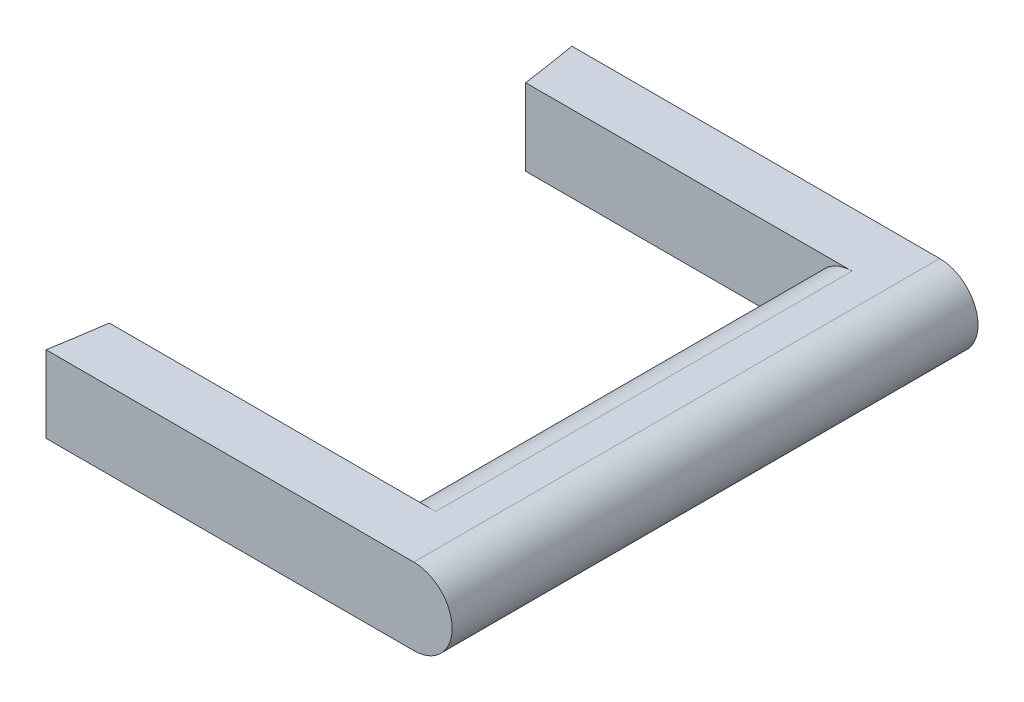
from build123d import *

# Parameters (mm, degrees)
BOSS_EXTRUDE1_DEPTH = 7
FILLET1_START       = -25
FILLET1_DEPTH       = 50
FILLET2_RADIUS      = 3.5
FILLET2_LENGTH      = 38.000003375


with BuildPart() as part:
    # Sketch1 → Boss-Extrude1 (new body)
    with BuildSketch(Plane(origin=(0, 0, 0), x_dir=(1, 0, 0), z_dir=(0, 1, 0))):
        with BuildLine():
            Line((137.927515414, 24.000010242), (175, 24.000010242))
            Line((175, 24.000010242), (175, -24))
            Line((175, -24), (137.927515472, -24.000009912))
            ThreePointArc((137.927515472, -24.000009912), (138.338710325, -21.50351659), (138.704722342, -19))
            Line((138.704722342, -19), (165, -19))
            Line((165, -19), (165, 19.000003375))
            Line((165, 19.000003375), (138.70472188, 19.000003375))
            ThreePointArc((138.70472188, 19.000003375), (138.338710037, 21.503518438), (137.927515414, 24.000010242))
        make_face()
    extrude(amount=BOSS_EXTRUDE1_DEPTH)

    # Fillet1: read off the stored shape, not the designer's step
    # Fillet1 outline → Fillet1 (cut)
    with BuildSketch(Plane.XY.offset(FILLET1_START)):
        with BuildLine():
            ThreePointArc((171.5, 7), (173.974873734, 5.974873734), (175, 3.5))
            Line((175, 3.5), (175, 7))
            Line((175, 7), (171.5, 7))
        make_face()
        with BuildLine():
            ThreePointArc((175, 3.5), (173.974873734, 1.025126266), (171.5, 0))
            Line((171.5, 0), (175, 0))
            Line((175, 0), (175, 3.5))
        make_face()
    extrude(amount=FILLET1_DEPTH, mode=Mode.SUBTRACT)

    # Fillet2: full round fillet: the end face becomes a half cylinder, R = half its width
    fillet2_face = Plane((165, 3.5, -1.687e-06), x_dir=(0, 0, 1), z_dir=(-1, 0, 0))  # on the end face: x along it, z out of the body
    fillet2_slab = fillet2_face.offset(-FILLET2_RADIUS / 2) * Box(FILLET2_LENGTH, 2 * FILLET2_RADIUS, FILLET2_RADIUS, mode=Mode.PRIVATE)  # the body's end, R deep
    fillet2_round = Plane((168.5, 3.5, -1.687e-06), x_dir=(-1, 0, 0), z_dir=(0, 0, 1)) * Cylinder(FILLET2_RADIUS, FILLET2_LENGTH, mode=Mode.PRIVATE)  # its axis R under the face
    add(fillet2_slab - fillet2_round, mode=Mode.SUBTRACT)


solid = part.part
